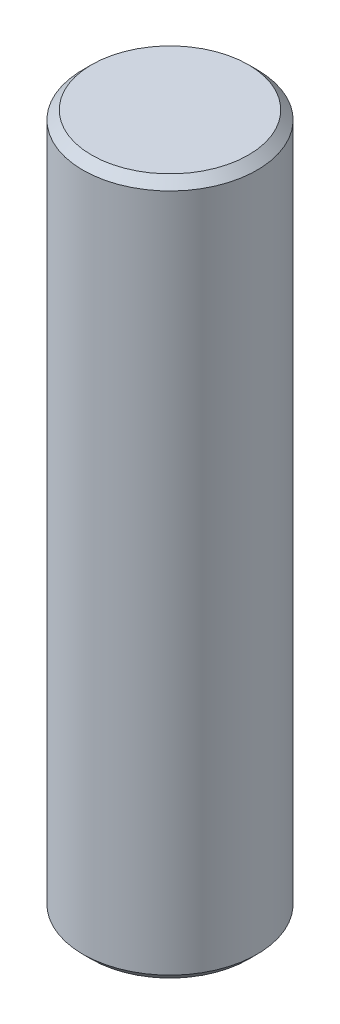
from build123d import *

# Parameters (mm, degrees)
SKETCH1_R           = 1
BOSS_EXTRUDE1_DEPTH = 8
CHAMFER1_SIZE       = 0.1


with BuildPart() as part:
    # Sketch1 → Boss-Extrude1 (new body)
    with BuildSketch(Plane(origin=(0, 0, 0), x_dir=(1, 0, 0), z_dir=(0, 1, 0))):
        Circle(SKETCH1_R)
    extrude(amount=BOSS_EXTRUDE1_DEPTH)

    # Chamfer1
    chamfer1_edges = [part.edges().sort_by_distance(p)[0] for p in [
        (-1, 0, 0),
        (-1, 8, 0),
    ]]
    chamfer(chamfer1_edges, length=CHAMFER1_SIZE)


solid = part.part
